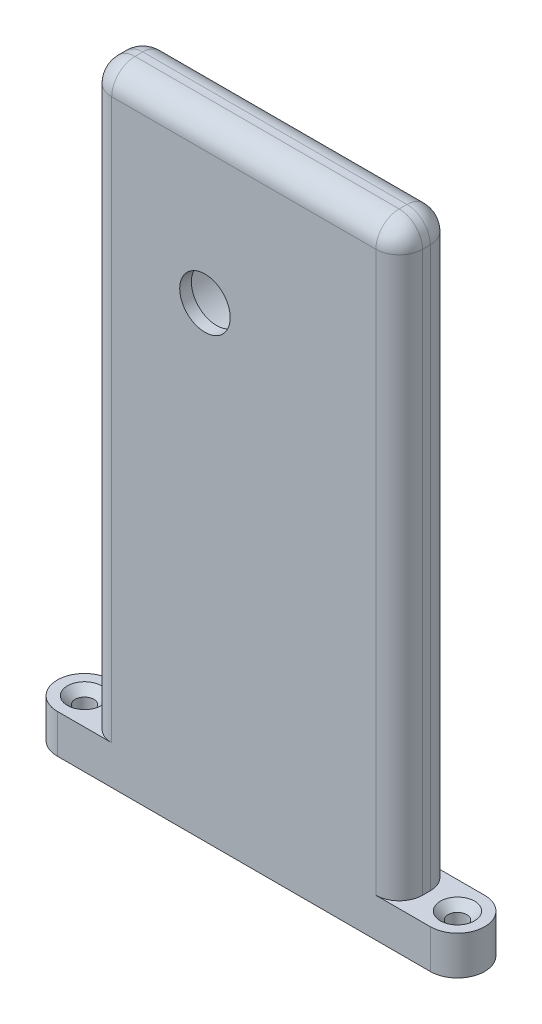
from build123d import *

# Parameters (mm, degrees)
CROQUIS1_W                   = 40
CROQUIS1_H                   = 80
CROQUIS1_R                   = 3.25
SALIENTE_EXTRUIR1_DEPTH      = 7
CROQUIS2_R                   = 6.5
CORTAR_EXTRUIR1_DEPTH        = 5
CROQUIS3_R                   = 6
CORTAR_EXTRUIR2_DEPTH        = 0.5
REDONDEO2_R                  = 3
SALIENTE_EXTRUIR2_DEPTH      = 5
TALADROAVANZADO1_OUTLINE_R   = 1.2
TALADROAVANZADO1_DEPTH       = 1
TALADROAVANZADO1_DRAFT       = -45
TALADROAVANZADO1_2_OUTLINE_R = 1.2
TALADROAVANZADO1_2_DEPTH     = 1
TALADROAVANZADO1_2_DRAFT     = -45
CORTAR_EXTRUIR3_START        = 1
CROQUIS8_R                   = 1.2
CORTAR_EXTRUIR3_DEPTH        = 83.124903698


# Read off the part's stored shape, not the designer's step: TaladroAvanzado1
with BuildPart() as part:
    # Croquis1 → Saliente-Extruir1 (new body)
    with BuildSketch(Plane.XY):
        Rectangle(CROQUIS1_W, CROQUIS1_H)
        with Locations((-5, 20)):
            Circle(CROQUIS1_R, mode=Mode.SUBTRACT)
    extrude(amount=SALIENTE_EXTRUIR1_DEPTH)

    # Croquis2 → Cortar-Extruir1 (cut)
    with BuildSketch(Plane(origin=(0, 0, 0), x_dir=(-1, 0, 0), z_dir=(0, 0, -1))):
        with Locations((5, 20)):
            Circle(CROQUIS2_R)
    extrude(amount=-CORTAR_EXTRUIR1_DEPTH, mode=Mode.SUBTRACT)

    # Croquis3 → Cortar-Extruir2 (cut)
    with BuildSketch(Plane(origin=(0, 0, 5), x_dir=(-1, 0, 0), z_dir=(0, 0, -1))):
        with Locations((5, 20)):
            Circle(CROQUIS3_R)
    extrude(amount=-CORTAR_EXTRUIR2_DEPTH, mode=Mode.SUBTRACT)

    # Redondeo2
    redondeo2_edges = [part.edges().sort_by_distance(p)[0] for p in [
        (-20, 40, 3.5),
        (20, 40, 3.5),
        (20, 0, 7),
        (0, 40, 7),
        (-20, 0, 7),
        (-20, 0, 0),
        (0, 40, 0),
        (20, 0, 0),
    ]]
    fillet(redondeo2_edges, radius=REDONDEO2_R)

    # Croquis4 → Saliente-Extruir2 (add)
    with BuildSketch(Plane.XZ.offset(40)):
        with BuildLine():
            Line((-17, 7), (-24, 7))
            ThreePointArc((-24, 7), (-27.5, 3.5), (-24, 0))
            Line((-24, 0), (-17, 0))
            Line((-17, 0), (-17, 7))
        make_face()
        with BuildLine():
            Line((17, 7), (24, 7))
            ThreePointArc((24, 7), (27.5, 3.5), (24, 0))
            Line((24, 0), (17, 0))
            Line((17, 0), (17, 7))
        make_face()
    extrude(amount=-SALIENTE_EXTRUIR2_DEPTH)


with BuildPart() as taladroavanzado1_tool:
    # TaladroAvanzado1 outline → TaladroAvanzado1 (with draft: the straight prism first)
    with BuildSketch(Plane(origin=(0, -36, 0), x_dir=(1, 0, 0), z_dir=(0, 1, 0))):
        with Locations((24, -3.5)):
            Circle(TALADROAVANZADO1_OUTLINE_R)
    extrude(amount=TALADROAVANZADO1_DEPTH)
    # TaladroAvanzado1: the draft: its side faces are tilted about the plane it starts from
    taladroavanzado1_sides = [taladroavanzado1_tool.faces().sort_by_distance(p)[0] for p in [
        (22.8, -35.5, 3.5),
    ]]
    draft(taladroavanzado1_sides, Plane(origin=(0, -36, 0), x_dir=(1, 0, 0), z_dir=(0, 1, 0)), TALADROAVANZADO1_DRAFT)


with BuildPart() as part_1:
    add(part.part)

    # TaladroAvanzado1: cut by taladroavanzado1_tool
    add(taladroavanzado1_tool.part, mode=Mode.SUBTRACT)


with BuildPart() as taladroavanzado1_2_tool:
    # TaladroAvanzado1 2 outline → TaladroAvanzado1 2 (with draft: the straight prism first)
    with BuildSketch(Plane(origin=(0, -36, 0), x_dir=(1, 0, 0), z_dir=(0, 1, 0))):
        with Locations((-24, -3.5)):
            Circle(TALADROAVANZADO1_2_OUTLINE_R)
    extrude(amount=TALADROAVANZADO1_2_DEPTH)
    # TaladroAvanzado1 2: the draft: its side faces are tilted about the plane it starts from
    taladroavanzado1_2_sides = [taladroavanzado1_2_tool.faces().sort_by_distance(p)[0] for p in [
        (-25.2, -35.5, 3.5),
    ]]
    draft(taladroavanzado1_2_sides, Plane(origin=(0, -36, 0), x_dir=(1, 0, 0), z_dir=(0, 1, 0)), TALADROAVANZADO1_2_DRAFT)


with BuildPart() as part_2:
    add(part_1.part)

    # TaladroAvanzado1 2: cut by taladroavanzado1_2_tool
    add(taladroavanzado1_2_tool.part, mode=Mode.SUBTRACT)

    # Croquis8 → Cortar-Extruir3 (cut, through all)
    with BuildSketch(Plane(origin=(0, -36, 0), x_dir=(1, 0, 0), z_dir=(0, 1, 0)).offset(CORTAR_EXTRUIR3_START)):
        with Locations(Location((24, -3.5, 0), (0, 0, 90))):
            Circle(CROQUIS8_R)
        with Locations(Location((-24, -3.5, 0), (0, 0, 90))):
            Circle(CROQUIS8_R)
    extrude(amount=-CORTAR_EXTRUIR3_DEPTH, mode=Mode.SUBTRACT)


solid = part_2.part
